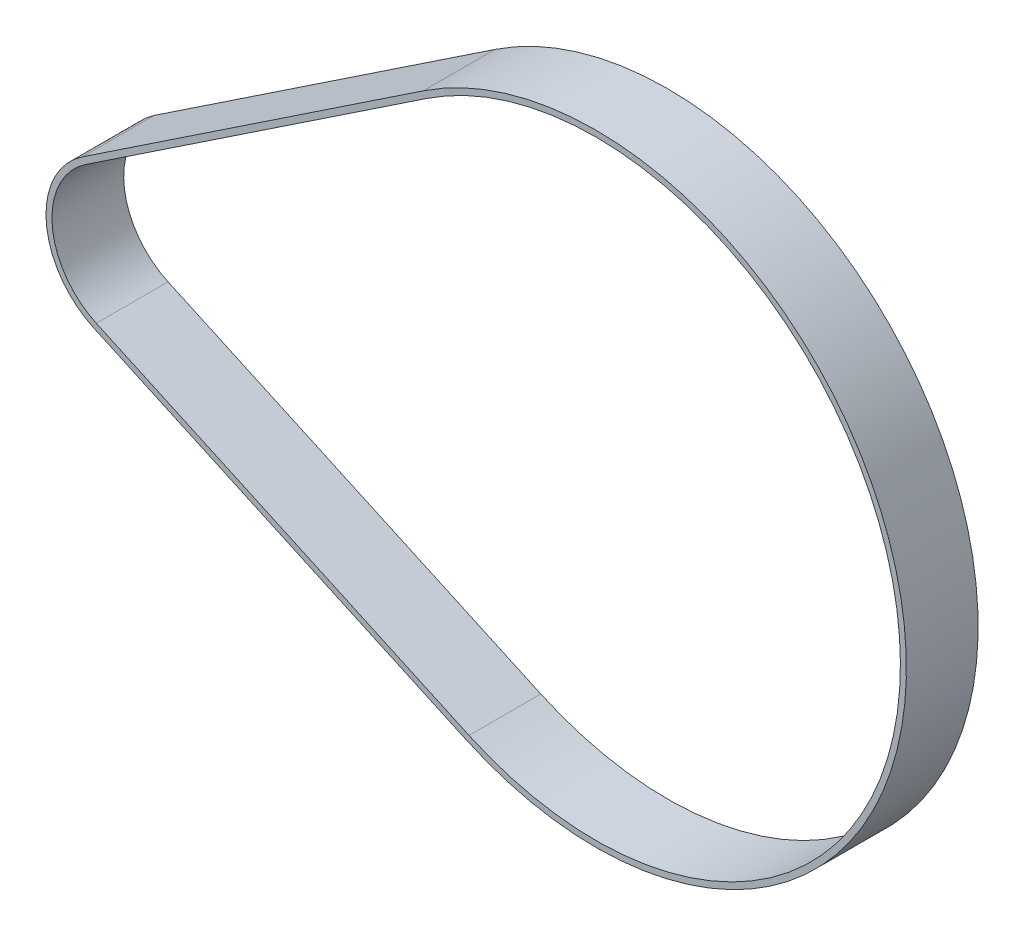
from build123d import *

# Parameters (mm, degrees)
BOSS_EXTRUDE1_DEPTH      = 4
BOSS_EXTRUDE1_DEPTH_BACK = 2


with BuildPart() as part:
    # Sketch3 → Boss-Extrude1 (new, two sides: drawn at the far end of the back side and taken through both)
    with BuildSketch(Plane.XY.offset(-BOSS_EXTRUDE1_DEPTH_BACK)):
        with BuildLine():
            Line((-3.803846336, 5.696775672), (24.708284265, 24.734871916))
            ThreePointArc((24.708284265, 24.734871916), (65.032506622, 5.199104), (28.324251817, -20.49512037))
            Line((28.324251817, -20.49512037), (-2.850444576, -6.228761171))
            ThreePointArc((-2.850444576, -6.228761171), (-6.828213831, -0.545889982), (-3.803846336, 5.696775672))
        make_face()
        with BuildLine():
            Line((-3.526193319, 5.28095263), (24.985937282, 24.319048874))
            ThreePointArc((24.985937282, 24.319048874), (64.534096854, 5.159258016), (28.532313465, -20.04046627))
            Line((28.532313465, -20.04046627), (-2.642382928, -5.774107071))
            ThreePointArc((-2.642382928, -5.774107071), (-6.329804063, -0.506043998), (-3.526193319, 5.28095263))
        make_face(mode=Mode.SUBTRACT)
    extrude(amount=BOSS_EXTRUDE1_DEPTH + BOSS_EXTRUDE1_DEPTH_BACK)


solid = part.part
